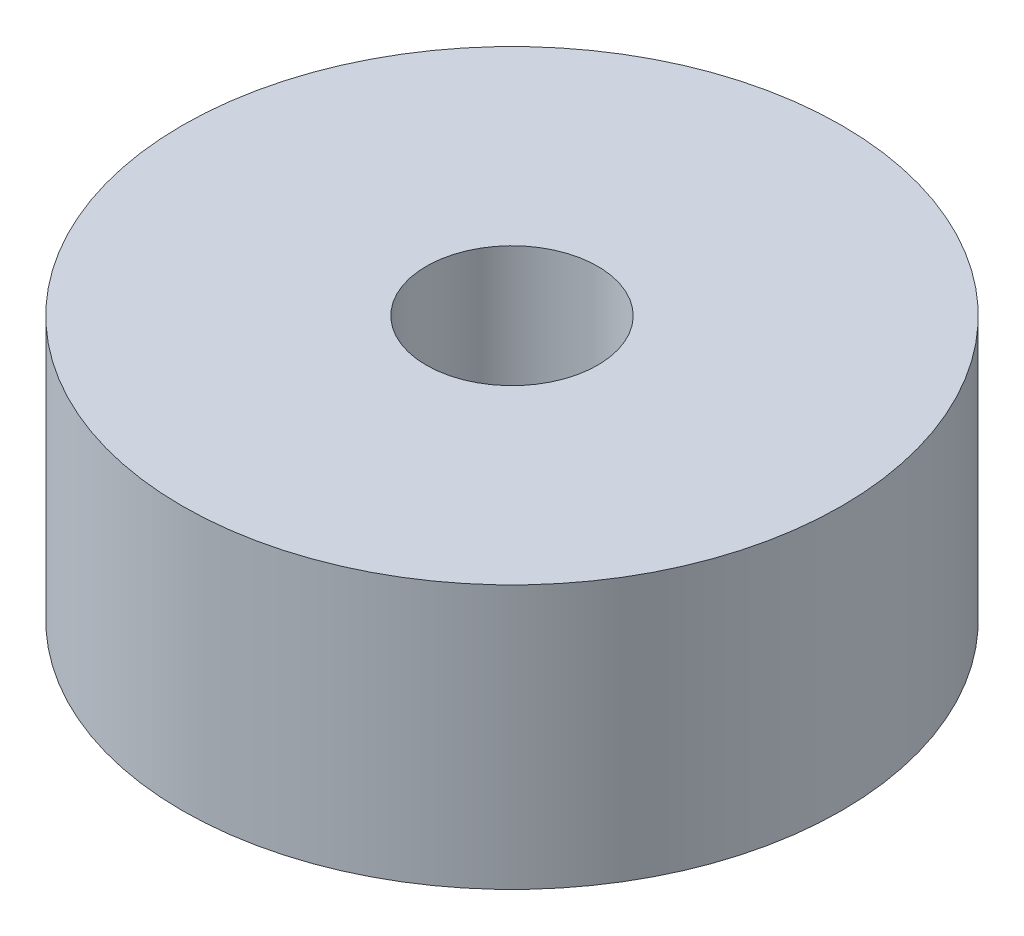
from build123d import *

# Parameters (mm, degrees)
SKETCH1_R           = 12.5
BOSS_EXTRUDE1_DEPTH = 10
SKETCH3_R           = 3.25
CUT_EXTRUDE2_DEPTH  = 21.310096012


with BuildPart() as part:
    # Sketch1 → Boss-Extrude1 (new body)
    with BuildSketch(Plane(origin=(0, 0, 0), x_dir=(1, 0, 0), z_dir=(0, 1, 0))):
        Circle(SKETCH1_R)
    extrude(amount=BOSS_EXTRUDE1_DEPTH)

    # Sketch3 → Cut-Extrude2 (cut, through all)
    with BuildSketch(Plane(origin=(0, 10, 0), x_dir=(1, 0, 0), z_dir=(0, 1, 0))):
        Circle(SKETCH3_R)
    extrude(amount=-CUT_EXTRUDE2_DEPTH, mode=Mode.SUBTRACT)


solid = part.part
